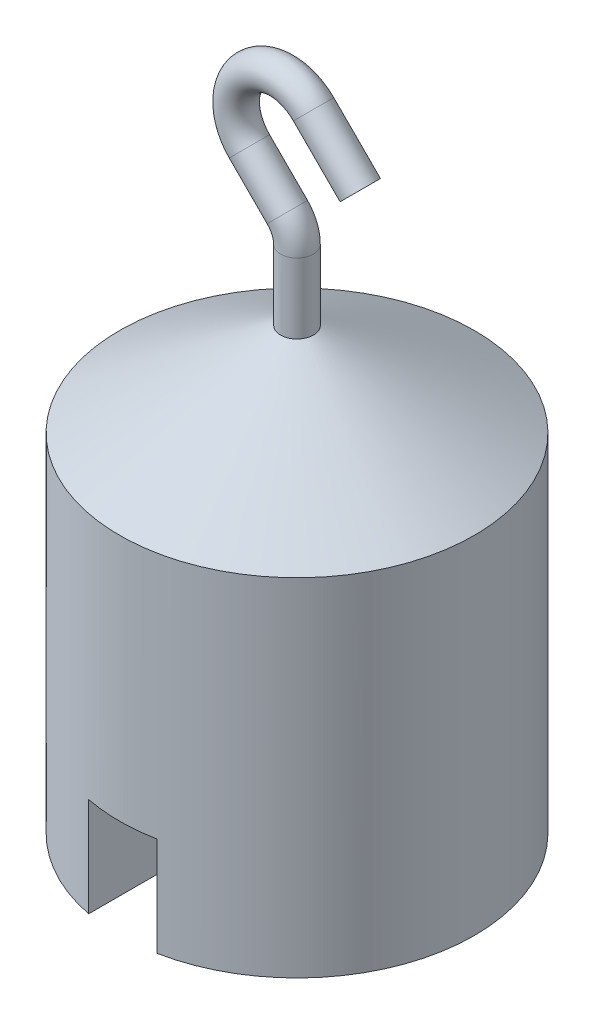
from build123d import *

# Parameters (mm, degrees)
SKETCH2_R                       = 21.5
BOSS_EXTRUDE1_DEPTH             = 42
SWEEP1_START                    = -52.999342031
SWEEP1_OUTLINE_R                = 1.997107907
SWEEP1_DEPTH                    = 6.5000001
SWEEP1_2_OUTLINE_R              = 1.997107907
SWEEP1_2_DEPTH                  = 8.0000001
SWEEP1_3_OUTLINE_R              = 1.997107907
SWEEP1_3_ANGLE                  = 45
SWEEP1_4_OUTLINE_R              = 1.997107907
SWEEP1_4_ANGLE                  = 180
SWEEP1_START_2                  = 52
SWEEP1_5_OUTLINE_R              = 1.997107907
SWEEP1_5_DEPTH                  = 9.7600001
SKETCH6_W                       = 14.45
SKETCH6_H                       = 6
CUT_EXTRUDE1_DEPTH              = 1.25
CUT_EXTRUDE2_DEPTH              = 87.117109058
CUT_EXTRUDE2_DEPTH_BACK         = 87.117109058
SKETCH7_W                       = 8.3
SKETCH7_H                       = 12
BOSS_EXTRUDE3_REACH             = 88.117
SKETCH8_R                       = 1.5
BOSS_EXTRUDE3_DIRECTION_2_REACH = 88.117
CUT_EXTRUDE3_DEPTH              = 0.5


with BuildPart() as part:
    # Sketch2 → Boss-Extrude1 (new body)
    with BuildSketch(Plane(origin=(0, 0, 0), x_dir=(1, 0, 0), z_dir=(0, 1, 0))):
        with Locations(Location((0, 0, 0), (0, 0, 90))):
            Circle(SKETCH2_R)
    extrude(amount=BOSS_EXTRUDE1_DEPTH)

    # Sketch3 → Revolve1 (revolve)
    with BuildSketch(Plane.XY, mode=Mode.PRIVATE) as revolve1_sk:
        Polygon((-21.5, 42), (-1.997107907, 53.26), (0, 53.26), (0, 42), align=None)
    revolve(revolve1_sk.sketch.rotate(Axis((0, 42, 0), (0, 1, 0)), 270), axis=Axis((0, 42, 0), (0, 1, 0)))



with BuildPart() as body_2:
    # Sweep1: read off the stored shape, not the designer's step
    # Sweep1 outline → Sweep1 (new body)
    with BuildSketch(Plane(origin=(0, 0, 0), x_dir=(0.707106781186549, 0.707106781186546, 0), z_dir=(0.707106781186546, -0.707106781186549, 0)).offset(SWEEP1_START)):
        with Locations((44.842487681, 0)):
            Circle(SWEEP1_OUTLINE_R)
        with Locations((55.842487681, 0)):
            Circle(SWEEP1_OUTLINE_R)
    extrude(amount=SWEEP1_DEPTH)

    # Sweep1 2 outline → Sweep1 2 (add)
    with BuildSketch(Plane(origin=(0, 0, 0), x_dir=(0.707106781186549, 0.707106781186546, 0), z_dir=(0.707106781186546, -0.707106781186549, 0)).offset(SWEEP1_START)):
        with Locations((55.842487681, 0)):
            Circle(SWEEP1_2_OUTLINE_R)
    extrude(amount=SWEEP1_2_DEPTH)

    # Sweep1 3 outline → Sweep1 3 (revolve)
    with BuildSketch(Plane(origin=(-4, 61.76, 0), x_dir=(1, 0, 0), z_dir=(0, -1, 0))):
        with Locations((4, 0)):
            Circle(SWEEP1_3_OUTLINE_R)
    revolve(axis=Axis((-4, 61.76, 0), (0, 0, 1)), revolution_arc=SWEEP1_3_ANGLE)

    # Sweep1 4 outline → Sweep1 4 (revolve)
    with BuildSketch(Plane(origin=(-1.878679656, 73.073708499, 0), x_dir=(0.7071067811865551, 0.7071067811865399, 0), z_dir=(0.7071067811865399, -0.7071067811865551, 0))):
        with Locations((5.5, 0)):
            Circle(SWEEP1_4_OUTLINE_R)
    revolve(axis=Axis((-1.878679656, 73.073708499, 0), (0, 0, 1)), revolution_arc=SWEEP1_4_ANGLE)


with BuildPart() as part_1:
    add(part.part)

    add(body_2.part)  # Sweep1 5 merges body 2
    # Sweep1 5 outline → Sweep1 5 (add)
    with BuildSketch(Plane(origin=(0, 0, 0), x_dir=(1, 0, 0), z_dir=(0, 1, 0)).offset(SWEEP1_START_2)):
        Circle(SWEEP1_5_OUTLINE_R)
    extrude(amount=SWEEP1_5_DEPTH)

    # Sketch6 → Cut-Extrude1 (cut)
    with BuildSketch(Plane.ZY.offset(21.5)):
        with Locations((0, 30)):
            Rectangle(SKETCH6_W, SKETCH6_H)
    extrude(amount=-CUT_EXTRUDE1_DEPTH, mode=Mode.SUBTRACT)

    # Sketch7 → Cut-Extrude2 (cut, two sides: drawn at the far end of the back side and taken through both)
    with BuildSketch(Plane.XY.offset(-CUT_EXTRUDE2_DEPTH_BACK)):
        with Locations((0, 6)):
            Rectangle(SKETCH7_W, SKETCH7_H)
    extrude(amount=CUT_EXTRUDE2_DEPTH + CUT_EXTRUDE2_DEPTH_BACK, mode=Mode.SUBTRACT)

    # Boss-Extrude3: up to this face of the body (flat: up to its plane)
    boss_extrude3_end = Plane(part_1.part.faces().sort_by_distance((4.15, 6, 0))[0])
    # Sketch8 → Boss-Extrude3 (add, up to the picked face)
    with BuildSketch(Plane(origin=(0, 0, 0), x_dir=(0, 0, -1), z_dir=(1, 0, 0)), mode=Mode.PRIVATE) as boss_extrude3_sk1:
        with Locations(Location((0, 4.5, 0), (0, 0, 180))):
            Circle(SKETCH8_R)
    boss_extrude3_tool1 = split(extrude(boss_extrude3_sk1.sketch, amount=BOSS_EXTRUDE3_REACH, mode=Mode.PRIVATE), bisect_by=boss_extrude3_end, keep=Keep.BOTH, mode=Mode.PRIVATE)
    add(boss_extrude3_tool1.solids().sort_by(Axis((0, 4.5, 0), (1, 0, 0)))[0])

    # Boss-Extrude3 direction 2: up to this face of the body (flat: up to its plane)
    boss_extrude3_direction_2_end = Plane(part_1.part.faces().sort_by_distance((-4.15, 6, 0))[0])
    # Sketch8 → Boss-Extrude3 direction 2 (add, up to the picked face)
    with BuildSketch(Plane(origin=(0, 0, 0), x_dir=(0, 0, -1), z_dir=(1, 0, 0)), mode=Mode.PRIVATE) as boss_extrude3_direction_2_sk1:
        with Locations(Location((0, 4.5, 0), (0, 0, 180))):
            Circle(SKETCH8_R)
    boss_extrude3_direction_2_tool1 = split(extrude(boss_extrude3_direction_2_sk1.sketch, amount=-BOSS_EXTRUDE3_DIRECTION_2_REACH, mode=Mode.PRIVATE), bisect_by=boss_extrude3_direction_2_end, keep=Keep.BOTH, mode=Mode.PRIVATE)
    add(boss_extrude3_direction_2_tool1.solids().sort_by(Axis((0, 4.5, 0), (-1, 0, 0)))[0])

    # Sketch9 → Cut-Extrude3 (cut)
    # profile 1 of 4: a face of its own
    with BuildSketch(Plane.ZY.offset(20.25)):
        with BuildLine():
            Line((-2.421955128, 31.425), (-2.421955128, 31.099358974))
            Line((-2.421955128, 31.099358974), (-3.501913061, 31.099358974))
            Line((-3.501913061, 31.099358974), (-3.673001803, 30.264267829))
            add(Edge.make_bspline(
                [(-3.673001803, 30.264267829), (-3.639386831, 30.273548147), (-3.57426314, 30.291527295), (-3.478142409, 30.311489672), (-3.38689091, 30.323523325), (-3.327676824, 30.325166443), (-3.299023437, 30.325961538)],
                knots=[0, 0, 0, 0, 1.100273476, 2.13160584, 3.095893838, 4, 4, 4, 4], degree=3))
            add(Edge.make_bspline(
                [(-3.299023437, 30.325961538), (-3.263568902, 30.325194154), (-3.193856427, 30.323685284), (-3.09185824, 30.309196535), (-2.994491972, 30.286391041), (-2.901961251, 30.254531711), (-2.814094894, 30.213792167), (-2.731701321, 30.162901507), (-2.653543785, 30.103453414), (-2.581024432, 30.035104724), (-2.515234524, 29.959882972), (-2.457389662, 29.879004046), (-2.408256455, 29.793253952), (-2.368740627, 29.7018134), (-2.337186267, 29.605693311), (-2.3161841, 29.503882325), (-2.302198943, 29.397340102), (-2.300636492, 29.324492385), (-2.299839744, 29.287344752)],
                knots=[0, 0, 0, 0, 1.052922333, 2.070308379, 3.05430497, 4.020497103, 4.973039431, 5.925935799, 6.892292201, 7.88610001, 8.88166317, 9.857072816, 10.836096531, 11.812156883, 12.81219415, 13.836441305, 14.89672472, 16, 16, 16, 16], degree=3))
            add(Edge.make_bspline(
                [(-2.299839744, 29.287344752), (-2.300443062, 29.261471023), (-2.301641545, 29.210073227), (-2.307736264, 29.133742417), (-2.319470806, 29.059027561), (-2.335225813, 28.985918748), (-2.355675007, 28.914554389), (-2.380430077, 28.844730218), (-2.410725045, 28.776880824), (-2.443954935, 28.710364216), (-2.481371383, 28.646684142), (-2.522899029, 28.587131132), (-2.566773439, 28.53081182), (-2.61398241, 28.478330219), (-2.664964741, 28.430031196), (-2.719102997, 28.385628112), (-2.775965178, 28.344370048), (-2.836431005, 28.307931757), (-2.899153114, 28.274401075), (-2.965037283, 28.246893295), (-3.032583775, 28.222300173), (-3.10276477, 28.202697244), (-3.1754213, 28.187336998), (-3.250673132, 28.176904311), (-3.328125597, 28.169305685), (-3.380626501, 28.168830018), (-3.407146434, 28.168589744)],
                knots=[0, 0, 0, 0, 1.056347294, 2.098418968, 3.122841568, 4.141288669, 5.149314143, 6.15115421, 7.162517403, 8.180376062, 9.185164535, 10.17417709, 11.141909838, 12.097768115, 13.052685741, 14.0056014, 14.954263652, 15.917497458, 16.885230207, 17.854509472, 18.828990115, 19.81800267, 20.826176721, 21.857883937, 22.917946725, 24, 24, 24, 24], degree=3))
            add(Edge.make_bspline(
                [(-3.407146434, 28.168589744), (-3.438782298, 28.169216432), (-3.501022123, 28.170449368), (-3.592208638, 28.183347566), (-3.679942601, 28.201820547), (-3.763517765, 28.22961202), (-3.843683125, 28.264434781), (-3.919359448, 28.308445879), (-3.992480402, 28.35831978), (-4.060073464, 28.417175529), (-4.122807938, 28.481506183), (-4.178965985, 28.551317758), (-4.228980016, 28.625458038), (-4.272049115, 28.704287077), (-4.308786606, 28.787597745), (-4.337647345, 28.875702181), (-4.360941281, 28.968140042), (-4.370795955, 29.031779298), (-4.375801282, 29.064102564)],
                knots=[0, 0, 0, 0, 1.0467383, 2.05933395, 3.04377827, 4.011590433, 4.970194871, 5.932262533, 6.905835911, 7.896367577, 8.894135286, 9.877477877, 10.858688626, 11.851381753, 12.8477658, 13.868841284, 14.917554742, 16, 16, 16, 16], degree=3))
            Line((-4.375801282, 29.064102564), (-4.090865385, 29.064102564))
            add(Edge.make_bspline(
                [(-4.090865385, 29.064102564), (-4.083854479, 29.033825354), (-4.070379129, 28.975630874), (-4.040801057, 28.893868872), (-4.004637013, 28.821007861), (-3.961634497, 28.756084025), (-3.910335541, 28.699470149), (-3.85179813, 28.649017529), (-3.78616841, 28.603501518), (-3.713240266, 28.565562294), (-3.636302687, 28.533205639), (-3.555778146, 28.511659459), (-3.473859203, 28.496509363), (-3.418452396, 28.494992837), (-3.390609976, 28.494230769)],
                knots=[0, 0, 0, 0, 1.136247022, 2.183929868, 3.172523383, 4.106158343, 5.02341133, 5.958108904, 6.928429099, 7.938127109, 8.96079061, 9.975095812, 10.982467395, 12, 12, 12, 12], degree=3))
            add(Edge.make_bspline(
                [(-3.390609976, 28.494230769), (-3.363433387, 28.494975332), (-3.309922461, 28.496441382), (-3.231172132, 28.507725343), (-3.155141882, 28.525103997), (-3.082581922, 28.551111651), (-3.012222526, 28.582720789), (-2.945843463, 28.62328375), (-2.881524424, 28.669965339), (-2.821264617, 28.723447424), (-2.766074545, 28.782384219), (-2.717310064, 28.84541014), (-2.676691007, 28.912644708), (-2.64246078, 28.982923925), (-2.616468144, 29.057018045), (-2.597925254, 29.134579825), (-2.587036765, 29.215800843), (-2.585538909, 29.271199431), (-2.584775641, 29.299429087)],
                knots=[0, 0, 0, 0, 1.027316725, 2.022795036, 3.002884548, 3.971462791, 4.93288096, 5.914575861, 6.907176829, 7.935150275, 8.956128384, 9.956726525, 10.942570165, 11.921478529, 12.907843606, 13.90538589, 14.932640048, 16, 16, 16, 16], degree=3))
            add(Edge.make_bspline(
                [(-2.584775641, 29.299429087), (-2.585372976, 29.324897804), (-2.586542174, 29.374749195), (-2.596094906, 29.447682761), (-2.612711016, 29.516691878), (-2.635774107, 29.58210979), (-2.665056232, 29.643998198), (-2.700839673, 29.702420974), (-2.74379597, 29.756608094), (-2.79286504, 29.806584911), (-2.846620548, 29.852708476), (-2.905987372, 29.892027754), (-2.969723163, 29.925105737), (-3.037060014, 29.953651707), (-3.1095996, 29.974153812), (-3.185905403, 29.989546108), (-3.266801416, 29.998450044), (-3.32211054, 29.999685471), (-3.350540865, 30.000320513)],
                knots=[0, 0, 0, 0, 1.045622112, 2.046656509, 3.013763289, 3.955457236, 4.890082067, 5.820317437, 6.762574623, 7.722996705, 8.69280354, 9.665887285, 10.63943826, 11.638615906, 12.663482002, 13.728887084, 14.832589034, 16, 16, 16, 16], degree=3))
            add(Edge.make_bspline(
                [(-3.350540865, 30.000320513), (-3.375150679, 29.999793834), (-3.425963702, 29.998706375), (-3.50390798, 29.990699481), (-3.585815472, 29.977782407), (-3.671372193, 29.960014883), (-3.760835082, 29.936763834), (-3.854015346, 29.908901395), (-3.951108902, 29.875589296), (-4.01652998, 29.850432216), (-4.050160256, 29.8375)],
                knots=[0, 0, 0, 0, 0.817624296, 1.688186739, 2.600797293, 3.572016777, 4.590301741, 5.671205678, 6.80286297, 8, 8, 8, 8], degree=3))
            Line((-4.050160256, 29.8375), (-3.724519231, 31.425))
            Line((-3.724519231, 31.425), (-2.421955128, 31.425))
        make_face()
    # profile 2 of 4: a face of its own
    with BuildSketch(Plane.ZY.offset(20.25)):
        with BuildLine():
            add(Edge.make_bspline(
                [(-1.974198718, 29.836227965), (-1.973901159, 29.887116309), (-1.973323145, 29.985967652), (-1.966892935, 30.130008006), (-1.956211017, 30.265136268), (-1.941572115, 30.391358907), (-1.923757661, 30.508708507), (-1.89997647, 30.616871466), (-1.872931999, 30.716348394), (-1.841587994, 30.807463681), (-1.8062205, 30.891444883), (-1.767726564, 30.969844887), (-1.7245785, 31.042545069), (-1.679242301, 31.110705779), (-1.629882778, 31.173211273), (-1.57790459, 31.23094426), (-1.521279031, 31.282570441), (-1.461931016, 31.329602444), (-1.399323223, 31.370831607), (-1.335240233, 31.40714702), (-1.269240959, 31.438171185), (-1.201145207, 31.462564652), (-1.13156503, 31.482713063), (-1.060257191, 31.496491609), (-0.987103953, 31.50516109), (-0.937726866, 31.505989917), (-0.912685296, 31.506410256)],
                knots=[0, 0, 0, 0, 1.646270934, 3.197905019, 4.663502075, 6.030701355, 7.308322542, 8.50163776, 9.611534131, 10.641858119, 11.616356847, 12.558055219, 13.465016945, 14.349605745, 15.204443733, 16.039544428, 16.859896111, 17.680448484, 18.487036065, 19.28249412, 20.06191084, 20.843045899, 21.620316918, 22.403196591, 23.190181807, 24, 24, 24, 24], degree=3))
            add(Edge.make_bspline(
                [(-0.912685296, 31.506410256), (-0.887434541, 31.505967738), (-0.837218733, 31.505087709), (-0.762977821, 31.496629561), (-0.690452038, 31.482595043), (-0.619950584, 31.462709587), (-0.550894346, 31.438039223), (-0.483823462, 31.407117338), (-0.418321324, 31.371122937), (-0.355428849, 31.32882842), (-0.294455591, 31.281673069), (-0.236899224, 31.228366934), (-0.18275451, 31.16944826), (-0.131341912, 31.105547427), (-0.084120049, 31.035438814), (-0.039149864, 30.9603418), (0.001101912, 30.878943087), (0.039868367, 30.792600805), (0.073330133, 30.698925915), (0.10350737, 30.598446454), (0.127890435, 30.489975584), (0.148200703, 30.374082419), (0.163935001, 30.250341345), (0.175394613, 30.119017616), (0.181448054, 29.980024833), (0.182588061, 29.884994498), (0.183173077, 29.836227965)],
                knots=[0, 0, 0, 0, 0.810914788, 1.612654377, 2.396697861, 3.181598691, 3.963628158, 4.749916497, 5.551656086, 6.361998678, 7.18212741, 8.025565596, 8.878627764, 9.750805457, 10.657531673, 11.591944965, 12.560506719, 13.57287815, 14.630710178, 15.753379473, 16.941251878, 18.199788006, 19.531962791, 20.947069417, 22.433333509, 24, 24, 24, 24], degree=3))
            add(Edge.make_bspline(
                [(0.183173077, 29.836227965), (0.182581997, 29.787674134), (0.181430301, 29.693068975), (0.175462474, 29.55470159), (0.163707144, 29.424074794), (0.149002369, 29.300875303), (0.128636138, 29.185615891), (0.103594309, 29.077897713), (0.075790088, 28.977255591), (0.041468524, 28.884514012), (0.003903094, 28.798379235), (-0.036968405, 28.717945464), (-0.080756033, 28.642501756), (-0.128461537, 28.572651986), (-0.179309991, 28.507901347), (-0.234389699, 28.449392789), (-0.292148016, 28.395716537), (-0.353300707, 28.347953989), (-0.417174043, 28.306148487), (-0.482451206, 28.268761637), (-0.550290418, 28.238614835), (-0.61915431, 28.212729477), (-0.6900279, 28.192953353), (-0.76282284, 28.179279212), (-0.837168854, 28.169689035), (-0.887425988, 28.168957443), (-0.912685296, 28.168589744)],
                knots=[0, 0, 0, 0, 1.561518951, 3.042555995, 4.452378317, 5.7783523, 7.031515105, 8.214008947, 9.334062868, 10.386615937, 11.391082383, 12.354592575, 13.286541444, 14.194233754, 15.072674879, 15.931287219, 16.775624067, 17.606195743, 18.42308326, 19.229000347, 20.022332153, 20.807536673, 21.593273796, 22.3848459, 23.188221202, 24, 24, 24, 24], degree=3))
            add(Edge.make_bspline(
                [(-0.912685296, 28.168589744), (-0.937726171, 28.169012795), (-0.987101889, 28.169846969), (-1.06026516, 28.178477282), (-1.13127852, 28.192352489), (-1.20049239, 28.211780408), (-1.268261871, 28.23556101), (-1.333663503, 28.26654328), (-1.397424473, 28.302224899), (-1.45937467, 28.342860746), (-1.518349988, 28.389416844), (-1.574682294, 28.440910163), (-1.626956418, 28.498625686), (-1.675610205, 28.561652088), (-1.721850985, 28.629409529), (-1.764386345, 28.702823125), (-1.803729906, 28.781601779), (-1.839692215, 28.866254455), (-1.871577074, 28.958016425), (-1.899741781, 29.057937466), (-1.921979623, 29.166899507), (-1.941014162, 29.284027404), (-1.956366995, 29.40982447), (-1.966848418, 29.544358997), (-1.973326611, 29.687547151), (-1.973902711, 29.785763303), (-1.974198718, 29.836227965)],
                knots=[0, 0, 0, 0, 0.810891512, 1.598919785, 2.382837074, 3.152667961, 3.926044502, 4.706494248, 5.493654104, 6.291793342, 7.103789334, 7.925228297, 8.761435821, 9.622817696, 10.50288917, 11.416980706, 12.369136599, 13.353924996, 14.394355917, 15.514179734, 16.714354668, 17.994756427, 19.357759367, 20.818452758, 22.365282078, 24, 24, 24, 24], degree=3))
        make_face()
        with BuildLine():
            add(Edge.make_bspline(
                [(-1.689262821, 29.8375), (-1.689154465, 29.795092252), (-1.688944168, 29.71278714), (-1.683450329, 29.593186467), (-1.67596619, 29.481634812), (-1.666313013, 29.377990532), (-1.651977481, 29.28260445), (-1.635914895, 29.194820523), (-1.6163677, 29.115103315), (-1.593240076, 29.042905801), (-1.566897467, 28.977002717), (-1.538135719, 28.915678758), (-1.507237778, 28.858209501), (-1.472658263, 28.805111156), (-1.43499817, 28.756210565), (-1.395108142, 28.71064221), (-1.35149944, 28.670004948), (-1.291171045, 28.621267015), (-1.211527101, 28.57090323), (-1.111178545, 28.52704642), (-1.008065021, 28.499485191), (-0.938077816, 28.495980213), (-0.903145032, 28.494230769)],
                knots=[0, 0, 0, 0, 1.459021318, 2.831673884, 4.118529203, 5.306027144, 6.411944654, 7.436330062, 8.375795394, 9.233974572, 10.042671642, 10.816086306, 11.563610507, 12.285937304, 12.993564865, 13.685989202, 14.367179055, 15.041617293, 16.353048772, 17.594441528, 18.799311195, 20, 20, 20, 20], degree=3))
            add(Edge.make_bspline(
                [(-0.903145032, 28.494230769), (-0.867986287, 28.495680185), (-0.797741387, 28.498576023), (-0.695112873, 28.526514878), (-0.595481128, 28.568669388), (-0.517401582, 28.618514626), (-0.45799956, 28.665983896), (-0.415439148, 28.706455755), (-0.376375718, 28.751772864), (-0.339326122, 28.800667225), (-0.305345389, 28.854072978), (-0.274445257, 28.911733315), (-0.24624822, 28.973808354), (-0.230183585, 29.017142332), (-0.221970152, 29.039297877)],
                knots=[0, 0, 0, 0, 1.353760809, 2.704726607, 4.075137775, 5.516104923, 6.260822281, 7.007110065, 7.778089737, 8.566572457, 9.372053459, 10.217411131, 11.088608312, 12, 12, 12, 12], degree=3))
            add(Edge.make_bspline(
                [(-0.221970152, 29.039297877), (-0.212398191, 29.067627712), (-0.192963006, 29.125149426), (-0.167915182, 29.214379311), (-0.148188999, 29.307998961), (-0.130442231, 29.405448888), (-0.118329102, 29.50744776), (-0.1085793, 29.61367998), (-0.102836462, 29.724225644), (-0.102124581, 29.799332529), (-0.101762821, 29.8375)],
                knots=[0, 0, 0, 0, 0.884706709, 1.796334032, 2.740027952, 3.714592787, 4.726048262, 5.777819803, 6.87074269, 8, 8, 8, 8], degree=3))
            add(Edge.make_bspline(
                [(-0.101762821, 29.8375), (-0.102261921, 29.875661298), (-0.103238267, 29.950312955), (-0.106970242, 30.059640161), (-0.116607342, 30.163478773), (-0.127310828, 30.26227613), (-0.143092593, 30.355485333), (-0.160108604, 30.443886682), (-0.182969703, 30.526384997), (-0.207389785, 30.604271903), (-0.235339215, 30.676662497), (-0.266105631, 30.743894289), (-0.298963941, 30.806291861), (-0.334652973, 30.863684015), (-0.372749057, 30.916327822), (-0.414257691, 30.963167775), (-0.457532372, 31.005655596), (-0.518145105, 31.054153784), (-0.597496782, 31.103603679), (-0.696235334, 31.14911119), (-0.79898799, 31.175244427), (-0.868451052, 31.178928957), (-0.903145032, 31.180769231)],
                knots=[0, 0, 0, 0, 1.31362396, 2.569729283, 3.763502607, 4.902122613, 5.988968491, 7.01645872, 7.998833611, 8.933434873, 9.825090667, 10.667526885, 11.477055099, 12.250526234, 12.991942729, 13.710640831, 14.402115721, 15.076753259, 16.378508321, 17.609869233, 18.806226677, 20, 20, 20, 20], degree=3))
            add(Edge.make_bspline(
                [(-0.903145032, 31.180769231), (-0.938261069, 31.178926418), (-1.008557116, 31.175237437), (-1.112377761, 31.149208557), (-1.21189528, 31.103839652), (-1.291037121, 31.05399), (-1.351692128, 31.006511674), (-1.394402857, 30.965339677), (-1.434449741, 30.920303432), (-1.471341155, 30.870953123), (-1.505893576, 30.817916683), (-1.537626352, 30.760776875), (-1.566217073, 30.699244137), (-1.592600902, 30.633370657), (-1.615799074, 30.561179371), (-1.634934312, 30.481560356), (-1.652611853, 30.394055639), (-1.665126133, 30.298152943), (-1.676251111, 30.194482704), (-1.683400619, 30.082652565), (-1.688962546, 29.962851306), (-1.689160724, 29.880120641), (-1.689262821, 29.8375)],
                knots=[0, 0, 0, 0, 1.207732386, 2.417664972, 3.655092373, 4.956220595, 5.625982001, 6.301752483, 6.994047911, 7.697131622, 8.419323945, 9.170223765, 9.943494443, 10.752040957, 11.610060368, 12.549350801, 13.567764191, 14.679664412, 15.874934091, 17.154273443, 18.533957287, 20, 20, 20, 20], degree=3))
        make_face(mode=Mode.SUBTRACT)
    # profile 3 of 4: a face of its own
    with BuildSketch(Plane.ZY.offset(20.25)):
        with BuildLine():
            add(Edge.make_bspline(
                [(0.468108974, 29.836227965), (0.468406534, 29.887116309), (0.468984547, 29.985967652), (0.475414757, 30.130008006), (0.486096675, 30.265136268), (0.500735578, 30.391358907), (0.518550031, 30.508708507), (0.542331222, 30.616871466), (0.569375693, 30.716348394), (0.600719698, 30.807463681), (0.636087192, 30.891444883), (0.674581129, 30.969844887), (0.717729192, 31.042545069), (0.763065392, 31.110705779), (0.812424914, 31.173211273), (0.864403102, 31.23094426), (0.921028662, 31.282570441), (0.980376676, 31.329602444), (1.042984469, 31.370831607), (1.107067459, 31.40714702), (1.173066734, 31.438171185), (1.241162485, 31.462564652), (1.310742663, 31.482713063), (1.382050502, 31.496491609), (1.455203739, 31.50516109), (1.504580826, 31.505989917), (1.529622396, 31.506410256)],
                knots=[0, 0, 0, 0, 1.646270934, 3.197905019, 4.663502075, 6.030701355, 7.308322542, 8.50163776, 9.611534131, 10.641858119, 11.616356847, 12.558055219, 13.465016945, 14.349605745, 15.204443733, 16.039544428, 16.859896111, 17.680448484, 18.487036065, 19.28249412, 20.06191084, 20.843045899, 21.620316918, 22.403196591, 23.190181807, 24, 24, 24, 24], degree=3))
            add(Edge.make_bspline(
                [(1.529622396, 31.506410256), (1.554873151, 31.505967738), (1.605088959, 31.505087709), (1.679329871, 31.496629561), (1.751855654, 31.482595043), (1.822357108, 31.462709587), (1.891413346, 31.438039223), (1.95848423, 31.407117338), (2.023986368, 31.371122937), (2.086878844, 31.32882842), (2.147852102, 31.281673069), (2.205408468, 31.228366934), (2.259553182, 31.16944826), (2.31096578, 31.105547427), (2.358187643, 31.035438814), (2.403157828, 30.9603418), (2.443409604, 30.878943087), (2.482176059, 30.792600805), (2.515637826, 30.698925915), (2.545815062, 30.598446454), (2.570198127, 30.489975584), (2.590508395, 30.374082419), (2.606242694, 30.250341345), (2.617702305, 30.119017616), (2.623755746, 29.980024833), (2.624895754, 29.884994498), (2.625480769, 29.836227965)],
                knots=[0, 0, 0, 0, 0.810914788, 1.612654377, 2.396697861, 3.181598691, 3.963628158, 4.749916497, 5.551656086, 6.361998678, 7.18212741, 8.025565596, 8.878627764, 9.750805457, 10.657531673, 11.591944965, 12.560506719, 13.57287815, 14.630710178, 15.753379473, 16.941251878, 18.199788006, 19.531962791, 20.947069417, 22.433333509, 24, 24, 24, 24], degree=3))
            add(Edge.make_bspline(
                [(2.625480769, 29.836227965), (2.624889689, 29.787674134), (2.623737993, 29.693068975), (2.617770166, 29.55470159), (2.606014837, 29.424074794), (2.591310062, 29.300875303), (2.570943831, 29.185615891), (2.545902001, 29.077897713), (2.51809778, 28.977255591), (2.483776217, 28.884514012), (2.446210787, 28.798379235), (2.405339287, 28.717945464), (2.361551659, 28.642501756), (2.313846155, 28.572651986), (2.262997702, 28.507901347), (2.207917993, 28.449392789), (2.150159677, 28.395716537), (2.089006985, 28.347953989), (2.025133649, 28.306148487), (1.959856487, 28.268761637), (1.892017275, 28.238614835), (1.823153382, 28.212729477), (1.752279793, 28.192953353), (1.679484852, 28.179279212), (1.605138838, 28.169689035), (1.554881704, 28.168957443), (1.529622396, 28.168589744)],
                knots=[0, 0, 0, 0, 1.561518951, 3.042555995, 4.452378317, 5.7783523, 7.031515105, 8.214008947, 9.334062868, 10.386615937, 11.391082383, 12.354592575, 13.286541444, 14.194233754, 15.072674879, 15.931287219, 16.775624067, 17.606195743, 18.42308326, 19.229000347, 20.022332153, 20.807536673, 21.593273796, 22.3848459, 23.188221202, 24, 24, 24, 24], degree=3))
            add(Edge.make_bspline(
                [(1.529622396, 28.168589744), (1.504581521, 28.169012795), (1.455205804, 28.169846969), (1.382042532, 28.178477282), (1.311029172, 28.192352489), (1.241815303, 28.211780408), (1.174045821, 28.23556101), (1.10864419, 28.26654328), (1.04488322, 28.302224899), (0.982933022, 28.342860746), (0.923957705, 28.389416844), (0.867625399, 28.440910163), (0.815351274, 28.498625686), (0.766697487, 28.561652088), (0.720456707, 28.629409529), (0.677921347, 28.702823125), (0.638577787, 28.781601779), (0.602615477, 28.866254455), (0.570730618, 28.958016425), (0.542565912, 29.057937466), (0.520328069, 29.166899507), (0.501293531, 29.284027404), (0.485940698, 29.40982447), (0.475459274, 29.544358997), (0.468981081, 29.687547151), (0.468404981, 29.785763303), (0.468108974, 29.836227965)],
                knots=[0, 0, 0, 0, 0.810891512, 1.598919785, 2.382837074, 3.152667961, 3.926044502, 4.706494248, 5.493654104, 6.291793342, 7.103789334, 7.925228297, 8.761435821, 9.622817696, 10.50288917, 11.416980706, 12.369136599, 13.353924996, 14.394355917, 15.514179734, 16.714354668, 17.994756427, 19.357759367, 20.818452758, 22.365282078, 24, 24, 24, 24], degree=3))
        make_face()
        with BuildLine():
            add(Edge.make_bspline(
                [(0.753044872, 29.8375), (0.753153227, 29.795092252), (0.753363524, 29.71278714), (0.758857363, 29.593186467), (0.766341502, 29.481634812), (0.775994679, 29.377990532), (0.790330211, 29.28260445), (0.806392797, 29.194820523), (0.825939993, 29.115103315), (0.849067616, 29.042905801), (0.875410225, 28.977002717), (0.904171973, 28.915678758), (0.935069915, 28.858209501), (0.96964943, 28.805111156), (1.007309523, 28.756210565), (1.047199551, 28.71064221), (1.090808252, 28.670004948), (1.151136647, 28.621267015), (1.230780592, 28.57090323), (1.331129148, 28.52704642), (1.434242671, 28.499485191), (1.504229876, 28.495980213), (1.53916266, 28.494230769)],
                knots=[0, 0, 0, 0, 1.459021318, 2.831673884, 4.118529203, 5.306027144, 6.411944654, 7.436330062, 8.375795394, 9.233974572, 10.042671642, 10.816086306, 11.563610507, 12.285937304, 12.993564865, 13.685989202, 14.367179055, 15.041617293, 16.353048772, 17.594441528, 18.799311195, 20, 20, 20, 20], degree=3))
            add(Edge.make_bspline(
                [(1.53916266, 28.494230769), (1.574321405, 28.495680185), (1.644566306, 28.498576023), (1.74719482, 28.526514878), (1.846826565, 28.568669388), (1.924906111, 28.618514626), (1.984308132, 28.665983896), (2.026868545, 28.706455755), (2.065931974, 28.751772864), (2.102981571, 28.800667225), (2.136962304, 28.854072978), (2.167862436, 28.911733315), (2.196059472, 28.973808354), (2.212124107, 29.017142332), (2.22033754, 29.039297877)],
                knots=[0, 0, 0, 0, 1.353760809, 2.704726607, 4.075137775, 5.516104923, 6.260822281, 7.007110065, 7.778089737, 8.566572457, 9.372053459, 10.217411131, 11.088608312, 12, 12, 12, 12], degree=3))
            add(Edge.make_bspline(
                [(2.22033754, 29.039297877), (2.229909501, 29.067627712), (2.249344686, 29.125149426), (2.27439251, 29.214379311), (2.294118694, 29.307998961), (2.311865461, 29.405448888), (2.32397859, 29.50744776), (2.333728392, 29.61367998), (2.33947123, 29.724225644), (2.340183111, 29.799332529), (2.340544872, 29.8375)],
                knots=[0, 0, 0, 0, 0.884706709, 1.796334032, 2.740027952, 3.714592787, 4.726048262, 5.777819803, 6.87074269, 8, 8, 8, 8], degree=3))
            add(Edge.make_bspline(
                [(2.340544872, 29.8375), (2.340045772, 29.875661298), (2.339069425, 29.950312955), (2.33533745, 30.059640161), (2.325700351, 30.163478773), (2.314996864, 30.26227613), (2.299215099, 30.355485333), (2.282199089, 30.443886682), (2.259337989, 30.526384997), (2.234917907, 30.604271903), (2.206968477, 30.676662497), (2.176202061, 30.743894289), (2.143343751, 30.806291861), (2.107654719, 30.863684015), (2.069558635, 30.916327822), (2.028050001, 30.963167775), (1.98477532, 31.005655596), (1.924162587, 31.054153784), (1.84481091, 31.103603679), (1.746072359, 31.14911119), (1.643319703, 31.175244427), (1.573856641, 31.178928957), (1.53916266, 31.180769231)],
                knots=[0, 0, 0, 0, 1.31362396, 2.569729283, 3.763502607, 4.902122613, 5.988968491, 7.01645872, 7.998833611, 8.933434873, 9.825090667, 10.667526885, 11.477055099, 12.250526234, 12.991942729, 13.710640831, 14.402115721, 15.076753259, 16.378508321, 17.609869233, 18.806226677, 20, 20, 20, 20], degree=3))
            add(Edge.make_bspline(
                [(1.53916266, 31.180769231), (1.504046623, 31.178926418), (1.433750576, 31.175237437), (1.329929931, 31.149208557), (1.230412412, 31.103839652), (1.151270571, 31.05399), (1.090615565, 31.006511674), (1.047904836, 30.965339677), (1.007857951, 30.920303432), (0.970966537, 30.870953123), (0.936414116, 30.817916683), (0.90468134, 30.760776875), (0.87609062, 30.699244137), (0.849706791, 30.633370657), (0.826508619, 30.561179371), (0.80737338, 30.481560356), (0.789695839, 30.394055639), (0.77718156, 30.298152943), (0.766056581, 30.194482704), (0.758907073, 30.082652565), (0.753345146, 29.962851306), (0.753146968, 29.880120641), (0.753044872, 29.8375)],
                knots=[0, 0, 0, 0, 1.207732386, 2.417664972, 3.655092373, 4.956220595, 5.625982001, 6.301752483, 6.994047911, 7.697131622, 8.419323945, 9.170223765, 9.943494443, 10.752040957, 11.610060368, 12.549350801, 13.567764191, 14.679664412, 15.874934091, 17.154273443, 18.533957287, 20, 20, 20, 20], degree=3))
        make_face(mode=Mode.SUBTRACT)
    # profile 4 of 4: a face of its own
    with BuildSketch(Plane.ZY.offset(20.25)):
        with BuildLine():
            add(Edge.make_bspline(
                [(4.41650641, 30.773717949), (4.416042822, 30.748442363), (4.41513061, 30.698707028), (4.403501139, 30.625743214), (4.386734714, 30.55551984), (4.362411327, 30.488309453), (4.330906338, 30.424581364), (4.293390955, 30.36338526), (4.24751352, 30.306361423), (4.196698421, 30.25183938), (4.140320955, 30.202880873), (4.081145277, 30.159015336), (4.018259949, 30.122731496), (3.952759202, 30.092635271), (3.884040015, 30.069667628), (3.812481523, 30.053240822), (3.737980823, 30.042627546), (3.687242401, 30.041564077), (3.661553486, 30.041025641)],
                knots=[0, 0, 0, 0, 1.034311374, 2.035237678, 3.018835879, 3.988535298, 4.955586962, 5.926724039, 6.922210896, 7.948140028, 8.9758318, 9.976305946, 10.960823755, 11.944000181, 12.924372957, 13.922847624, 14.948335623, 16, 16, 16, 16], degree=3))
            add(Edge.make_bspline(
                [(3.661553486, 30.041025641), (3.635863095, 30.041559592), (3.58512176, 30.042614204), (3.510642306, 30.053292077), (3.438939163, 30.069497446), (3.370625028, 30.093299811), (3.30532112, 30.123475799), (3.242643934, 30.159701865), (3.183240544, 30.203285837), (3.127936014, 30.253207283), (3.077190884, 30.307622166), (3.032373814, 30.365560755), (2.994558422, 30.426937298), (2.964021766, 30.491684753), (2.939554788, 30.55932728), (2.92258799, 30.630147302), (2.911977819, 30.704068589), (2.910944306, 30.754388376), (2.910416667, 30.780078125)],
                knots=[0, 0, 0, 0, 1.048877944, 2.071648865, 3.067478027, 4.048049482, 5.020748126, 6.00265741, 7.000480754, 8.024717489, 9.042009667, 10.036368859, 11.012301115, 11.980826395, 12.956105095, 13.945510705, 14.951122056, 16, 16, 16, 16], degree=3))
            add(Edge.make_bspline(
                [(2.910416667, 30.780078125), (2.911239201, 30.804700628), (2.912855888, 30.853096054), (2.923018017, 30.924627649), (2.94113952, 30.99306948), (2.964926451, 31.059355759), (2.997713588, 31.12182944), (3.035412447, 31.182818264), (3.081958603, 31.239839119), (3.133629745, 31.29430775), (3.190207633, 31.343975625), (3.250268693, 31.387768283), (3.313602101, 31.42397354), (3.37937415, 31.454010583), (3.447648418, 31.477858031), (3.518700378, 31.494084821), (3.592321252, 31.504861136), (3.642433579, 31.505888091), (3.667913662, 31.506410256)],
                knots=[0, 0, 0, 0, 1.014023411, 1.9930587, 2.967060154, 3.925483522, 4.885932443, 5.866834192, 6.873010876, 7.910365301, 8.955806314, 9.968626493, 10.965901813, 11.95427271, 12.942643608, 13.937891749, 14.95150171, 16, 16, 16, 16], degree=3))
            add(Edge.make_bspline(
                [(3.667913662, 31.506410256), (3.693392059, 31.505881839), (3.743501071, 31.504842586), (3.816941335, 31.494185316), (3.887708232, 31.477700694), (3.955528182, 31.45431415), (4.020458627, 31.423775654), (4.083009421, 31.387750527), (4.142441159, 31.344174911), (4.197694039, 31.294011484), (4.249130163, 31.240044886), (4.293753669, 31.18196652), (4.331570889, 31.120987715), (4.36306212, 31.057501124), (4.386562302, 30.990521934), (4.403626958, 30.920879015), (4.415073671, 30.848296055), (4.416024964, 30.798778564), (4.41650641, 30.773717949)],
                knots=[0, 0, 0, 0, 1.048439503, 2.061992633, 3.048687608, 4.037003089, 5.009462214, 5.999126091, 7.004829708, 8.037155315, 9.068446971, 10.070659078, 11.046872281, 12.018978717, 12.982581913, 13.962845811, 14.969003949, 16, 16, 16, 16], degree=3))
        make_face()
        with BuildLine():
            add(Edge.make_bspline(
                [(4.131570513, 30.769901843), (4.131267864, 30.787094306), (4.130675295, 30.820756181), (4.124130999, 30.870183), (4.113272665, 30.917173659), (4.098707946, 30.962245841), (4.079355602, 31.004891628), (4.056441756, 31.045939037), (4.029087231, 31.084859166), (3.997301346, 31.120649996), (3.963090532, 31.153645383), (3.927080555, 31.183168277), (3.888516081, 31.207491222), (3.848087871, 31.227141512), (3.806329086, 31.243421046), (3.762218952, 31.253900948), (3.716724223, 31.261451865), (3.685542586, 31.261935601), (3.669821715, 31.262179487)],
                knots=[0, 0, 0, 0, 1.096623922, 2.14712783, 3.174374369, 4.171236163, 5.164418809, 6.157877864, 7.167601745, 8.193421799, 9.207667531, 10.198636131, 11.159501563, 12.109446627, 13.064292557, 14.01259837, 14.998010094, 16, 16, 16, 16], degree=3))
            add(Edge.make_bspline(
                [(3.669821715, 31.262179487), (3.653909177, 31.261569622), (3.622385978, 31.26036146), (3.575965463, 31.254426502), (3.531680357, 31.242320911), (3.488576766, 31.227356787), (3.447292326, 31.206825032), (3.407918672, 31.181791611), (3.369739518, 31.153172128), (3.335043063, 31.119298891), (3.301535842, 31.083900016), (3.274045857, 31.044547618), (3.249141721, 31.004390508), (3.2297633, 30.96174455), (3.21414581, 30.917516561), (3.2036086, 30.871190543), (3.196087515, 30.823148694), (3.195598879, 30.790284408), (3.195352564, 30.773717949)],
                knots=[0, 0, 0, 0, 1.009905464, 2.000652069, 2.9594965, 3.916453441, 4.890637365, 5.875526928, 6.87327472, 7.910035599, 8.947493813, 9.958830498, 10.948116093, 11.94077701, 12.923093136, 13.917846453, 14.95041344, 16, 16, 16, 16], degree=3))
            add(Edge.make_bspline(
                [(3.195352564, 30.773717949), (3.195582661, 30.757360981), (3.196036151, 30.725123654), (3.203744846, 30.677746323), (3.214168542, 30.631844511), (3.229567939, 30.587711004), (3.249556332, 30.545399616), (3.2736961, 30.504623104), (3.302525537, 30.465688682), (3.335369281, 30.429116735), (3.371232638, 30.395812179), (3.408866742, 30.366406659), (3.448030191, 30.34102726), (3.489212334, 30.321073137), (3.531693543, 30.304781824), (3.575593662, 30.293240936), (3.621306177, 30.286996011), (3.652207775, 30.285842625), (3.667913662, 30.28525641)],
                knots=[0, 0, 0, 0, 1.040322373, 2.050331958, 3.049090637, 4.035362045, 5.01978373, 6.024637172, 7.048002391, 8.099650942, 9.150432584, 10.160442169, 11.137896218, 12.11600268, 13.068812255, 14.031517462, 14.999509185, 16, 16, 16, 16], degree=3))
            add(Edge.make_bspline(
                [(3.667913662, 30.28525641), (3.683423833, 30.285496445), (3.714186338, 30.285972525), (3.75923795, 30.29361242), (3.803153204, 30.304003393), (3.844895966, 30.320311457), (3.885378993, 30.339887902), (3.923765313, 30.364501948), (3.960727026, 30.393088235), (3.995393558, 30.425952872), (4.026948246, 30.46206214), (4.055109445, 30.50018182), (4.079045533, 30.540568726), (4.097558421, 30.583117971), (4.113524124, 30.626900308), (4.124057826, 30.672816243), (4.130668144, 30.720732915), (4.131266617, 30.753342919), (4.131570513, 30.769901843)],
                knots=[0, 0, 0, 0, 0.997068568, 1.977562118, 2.934115304, 3.897265488, 4.855472182, 5.824694218, 6.82651453, 7.859454664, 8.89419623, 9.909588333, 10.906656901, 11.908477213, 12.89257309, 13.902171052, 14.934750522, 16, 16, 16, 16], degree=3))
        make_face(mode=Mode.SUBTRACT)
    extrude(amount=-CUT_EXTRUDE3_DEPTH, mode=Mode.SUBTRACT)


solid = part_1.part
